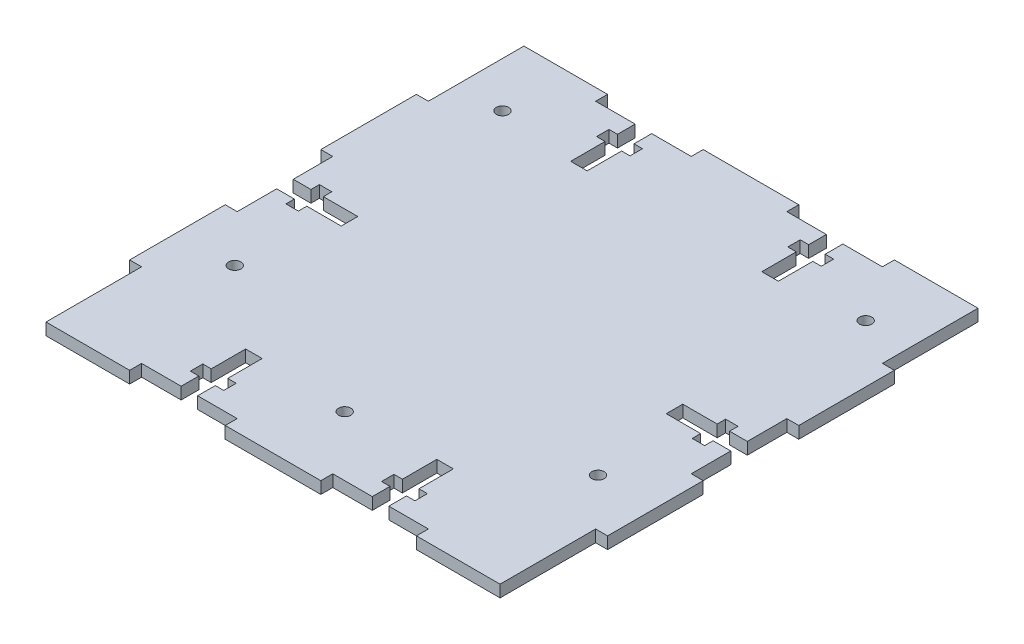
from build123d import *

# Parameters (mm, degrees)
SKETCH1_W                 = 127
SKETCH1_H                 = 127
BOSS_EXTRUDE1_DEPTH       = 3.175
SKETCH2_W                 = 3.175
SKETCH2_H                 = 25.4
CUT_EXTRUDE1_DEPTH        = 6.35
LPATTERN1_COUNT           = 3
LPATTERN1_PITCH           = 50.8
LPATTERN1_COUNT_DIR2      = 2
LPATTERN1_PITCH_DIR2      = 123.825
SKETCH3_W                 = 25.4
SKETCH3_H                 = 3.175
CUT_EXTRUDE2_DEPTH        = 6.35
LPATTERN2_COUNT           = 3
LPATTERN2_PITCH           = 50.8
LPATTERN2_COUNT_DIR2      = 2
LPATTERN2_PITCH_DIR2      = 123.825
SKETCH4_W                 = 17.145
SKETCH4_H                 = 4.3942
SKETCH4_W_2               = 3.302
SKETCH4_H_2               = 8.89
CUT_EXTRUDE3_DEPTH        = 8.89
SKETCH5_W                 = 4.3942
SKETCH5_H                 = 17.145
SKETCH5_W_2               = 8.89
SKETCH5_H_2               = 3.302
CUT_EXTRUDE4_DEPTH        = 30.48
LPATTERN3_COUNT           = 2
LPATTERN3_PITCH           = 50.8
MIRROR2_COPY_1_SKETCH_W   = 4.3942
MIRROR2_COPY_1_SKETCH_H   = 17.145
MIRROR2_COPY_1_SKETCH_W_2 = 8.89
MIRROR2_COPY_1_SKETCH_H_2 = 3.302
MIRROR2_COPY_1_DEPTH      = 30.48
MIRROR2_COPY_2_SKETCH_W   = 4.3942
MIRROR2_COPY_2_SKETCH_H   = 17.145
MIRROR2_COPY_2_SKETCH_W_2 = 8.89
MIRROR2_COPY_2_SKETCH_H_2 = 3.302
MIRROR2_COPY_2_DEPTH      = 30.48
F_4_CLEARANCE_HOLE4_D     = 3.2639
F_4_CLEARANCE_HOLE4_DEPTH = 10.16
F_4_CLEARANCE_HOLE4_TIP   = 0.980574487
F_4_CLEARANCE_HOLE5_D     = 3.2639
F_4_CLEARANCE_HOLE5_DEPTH = 10.16
F_4_CLEARANCE_HOLE5_TIP   = 0.980574487


with BuildPart() as part:
    # Sketch1 → Boss-Extrude1 (new body)
    with BuildSketch(Plane(origin=(0, 0, 0), x_dir=(1, 0, 0), z_dir=(0, 1, 0))):
        with Locations((63.5, 63.5)):
            Rectangle(SKETCH1_W, SKETCH1_H)
    extrude(amount=BOSS_EXTRUDE1_DEPTH)

    # Sketch2 → Cut-Extrude1 (cut)
    with BuildSketch(Plane(origin=(0, 3.175, 0), x_dir=(1, 0, 0), z_dir=(0, 1, 0))):
        with Locations((1.5875, 114.3)):
            Rectangle(SKETCH2_W, SKETCH2_H)
    cut_extrude1 = extrude(amount=-CUT_EXTRUDE1_DEPTH, mode=Mode.SUBTRACT)

    # LPattern1: Cut-Extrude1 3 × 2
    with Locations(*[(j * LPATTERN1_PITCH_DIR2, 0, i * LPATTERN1_PITCH) for i in range(LPATTERN1_COUNT) for j in range(LPATTERN1_COUNT_DIR2) if (i, j) != (0, 0)]):
        add(cut_extrude1, mode=Mode.SUBTRACT)

    # Sketch3 → Cut-Extrude2 (cut)
    with BuildSketch(Plane(origin=(0, 3.175, 0), x_dir=(1, 0, 0), z_dir=(0, 1, 0))):
        with Locations((38.1, 1.5875)):
            Rectangle(SKETCH3_W, SKETCH3_H)
    cut_extrude2 = extrude(amount=-CUT_EXTRUDE2_DEPTH, mode=Mode.SUBTRACT)

    # LPattern2: Cut-Extrude2 3 × 2
    with Locations(*[(i * LPATTERN2_PITCH, 0, -j * LPATTERN2_PITCH_DIR2) for i in range(LPATTERN2_COUNT) for j in range(LPATTERN2_COUNT_DIR2) if (i, j) != (0, 0)]):
        add(cut_extrude2, mode=Mode.SUBTRACT)

    # Sketch4 → Cut-Extrude3 (cut)
    with BuildSketch(Plane(origin=(0, 3.175, 0), x_dir=(1, 0, 0), z_dir=(0, 1, 0))):
        with Locations((115.2525, 63.5)):
            Rectangle(SKETCH4_W, SKETCH4_H)
        with Locations((117.475, 63.5)):
            Rectangle(SKETCH4_W_2, SKETCH4_H_2)
    cut_extrude3 = extrude(amount=-CUT_EXTRUDE3_DEPTH, mode=Mode.SUBTRACT)

    # Sketch5 → Cut-Extrude4 (cut)
    with BuildSketch(Plane(origin=(0, 3.175, 0), x_dir=(1, 0, 0), z_dir=(0, 1, 0))):
        with Locations((38.1, 11.7475)):
            Rectangle(SKETCH5_W, SKETCH5_H)
        with Locations((38.1, 9.525)):
            Rectangle(SKETCH5_W_2, SKETCH5_H_2)
    cut_extrude4 = extrude(amount=-CUT_EXTRUDE4_DEPTH, mode=Mode.SUBTRACT)

    # LPattern3: Cut-Extrude4 ×2
    with Locations(*[(i * LPATTERN3_PITCH, 0, 0) for i in range(1, LPATTERN3_COUNT)]):
        add(cut_extrude4, mode=Mode.SUBTRACT)

    # Mirror2 copy 1 sketch → Mirror2 copy 1 (cut)
    with BuildSketch(Plane(origin=(50.8, 3.175, -127), x_dir=(1, 0, 0), z_dir=(0, 1, 0))):
        with Locations((38.1, -11.7475)):
            Rectangle(MIRROR2_COPY_1_SKETCH_W, MIRROR2_COPY_1_SKETCH_H)
        with Locations((38.1, -9.525)):
            Rectangle(MIRROR2_COPY_1_SKETCH_W_2, MIRROR2_COPY_1_SKETCH_H_2)
    extrude(amount=-MIRROR2_COPY_1_DEPTH, mode=Mode.SUBTRACT)

    # Mirror2 copy 2 sketch → Mirror2 copy 2 (cut)
    with BuildSketch(Plane(origin=(0, 3.175, -127), x_dir=(1, 0, 0), z_dir=(0, 1, 0))):
        with Locations((38.1, -11.7475)):
            Rectangle(MIRROR2_COPY_2_SKETCH_W, MIRROR2_COPY_2_SKETCH_H)
        with Locations((38.1, -9.525)):
            Rectangle(MIRROR2_COPY_2_SKETCH_W_2, MIRROR2_COPY_2_SKETCH_H_2)
    extrude(amount=-MIRROR2_COPY_2_DEPTH, mode=Mode.SUBTRACT)

    # #4 Clearance Hole4
    with Locations(Plane(origin=(0, 3.175, 0), x_dir=(1, 0, 0), z_dir=(0, 1, 0))):
        with Locations((63.5, 19.05)):
            Hole(F_4_CLEARANCE_HOLE4_D / 2, depth=F_4_CLEARANCE_HOLE4_DEPTH)
            with Locations((0, 0, -(F_4_CLEARANCE_HOLE4_DEPTH + F_4_CLEARANCE_HOLE4_TIP / 2))):  # 118° drill point
                Cone(0, F_4_CLEARANCE_HOLE4_D / 2, F_4_CLEARANCE_HOLE4_TIP, mode=Mode.SUBTRACT)

    # Mirror3: Cut-Extrude3 across plane
    add(cut_extrude3.mirror(Plane.ZY.offset(-63.5)), mode=Mode.SUBTRACT)

    # #4 Clearance Hole5
    with Locations(Plane(origin=(0, 3.175, 0), x_dir=(1, 0, 0), z_dir=(0, 1, 0))):
        with Locations((15.24, 109.22), (111.76, 109.22), (111.76, 38.1), (15.24, 38.1)):
            Hole(F_4_CLEARANCE_HOLE5_D / 2, depth=F_4_CLEARANCE_HOLE5_DEPTH)
            with Locations((0, 0, -(F_4_CLEARANCE_HOLE5_DEPTH + F_4_CLEARANCE_HOLE5_TIP / 2))):  # 118° drill point
                Cone(0, F_4_CLEARANCE_HOLE5_D / 2, F_4_CLEARANCE_HOLE5_TIP, mode=Mode.SUBTRACT)


solid = part.part
